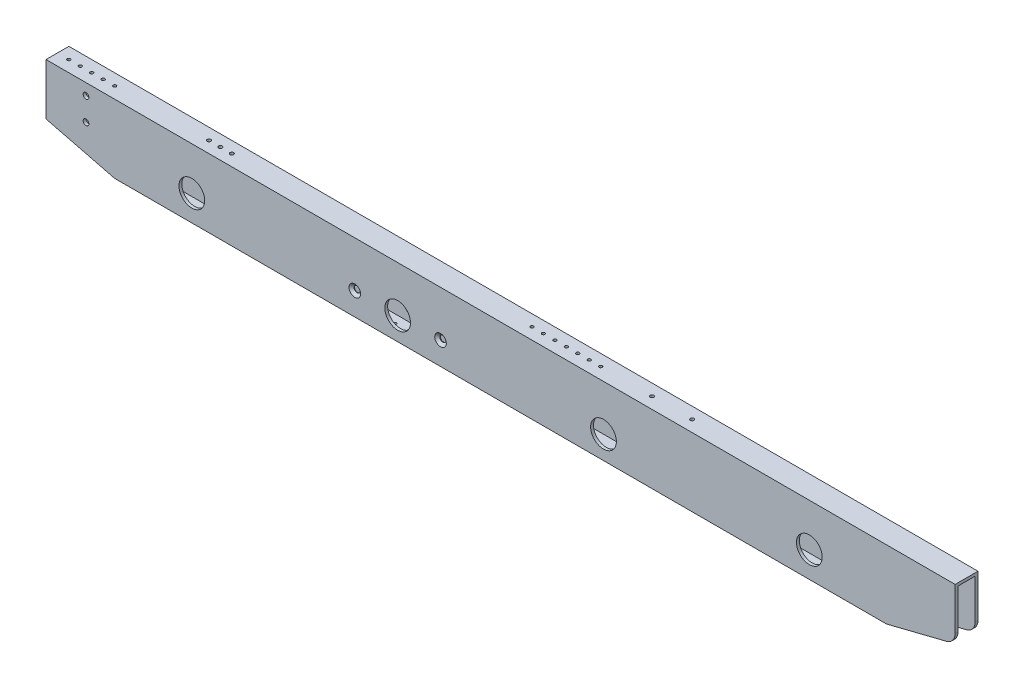
from build123d import *

# Parameters (mm, degrees)
SKETCH1_W                                           = 1009.65
SKETCH1_H                                           = 76.2
SKETCH1_R                                           = 14.2875
BOSS_EXTRUDE2_DEPTH                                 = 12.7
SKETCH3_W                                           = 19.05
SKETCH3_H                                           = 69.85
CUT_EXTRUDE2_DEPTH                                  = 1011.448426442
CUT_EXTRUDE3_DEPTH                                  = 507.897475457
FILLET1_R                                           = 12.7
SKETCH9_R                                           = 1.7272
CUT_EXTRUDE5_DEPTH                                  = 6.35
SKETCH12_R                                          = 1.7272
CUT_EXTRUDE8_DEPTH                                  = 5.08
CSK_FOR_1_4_FLAT_HEAD_MACHINE_SCREW_100_D           = 6.7564
CSK_FOR_1_4_FLAT_HEAD_MACHINE_SCREW_100_CSINK_D     = 12.8778
CSK_FOR_1_4_FLAT_HEAD_MACHINE_SCREW_100_CSINK_ANGLE = 100
CUT_EXTRUDE9_START                                  = -6.35
SKETCH15_R                                          = 1.7272
CUT_EXTRUDE9_DEPTH                                  = 6.35
SKETCH16_R                                          = 17.4625
CUT_EXTRUDE10_DEPTH                                 = 3.81
F_1_4_0_25_DIAMETER_HOLE1_D                         = 6.35
F_10_32_TAPPED_HOLE2_D                              = 4.0386
F_10_32_TAPPED_HOLE2_DEPTH                          = 13.716
F_10_32_TAPPED_HOLE2_TIP                            = 1.213317848
F_10_32_TAPPED_HOLE3_D                              = 4.0386


with BuildPart() as part:
    # Sketch1 → Boss-Extrude2 (new, symmetric)
    with BuildSketch(Plane.XY):
        Rectangle(SKETCH1_W, SKETCH1_H)
        with Locations((114.3, -12.7)):
            Circle(SKETCH1_R, mode=Mode.SUBTRACT)
        with Locations((-342.9, -9.525)):
            Circle(SKETCH1_R, mode=Mode.SUBTRACT)
        with Locations((342.9, -9.525)):
            Circle(SKETCH1_R, mode=Mode.SUBTRACT)
        with Locations((-114.3, -12.7)):
            Circle(SKETCH1_R, mode=Mode.SUBTRACT)
    extrude(amount=BOSS_EXTRUDE2_DEPTH, both=True)

    # Sketch3 → Cut-Extrude2 (cut, through all)
    with BuildSketch(Plane(origin=(504.825, 0, 0), x_dir=(0, 0, -1), z_dir=(1, 0, 0))):
        Rectangle(SKETCH3_W, SKETCH3_H)
    extrude(amount=-CUT_EXTRUDE2_DEPTH, mode=Mode.SUBTRACT)

    # Sketch4 → Cut-Extrude3 (cut, through all)
    with BuildSketch(Plane.XY.offset(12.7)):
        Polygon((-504.825, -38.1), (-504.825, -19.05), (-428.625, -38.1), align=None)
        Polygon((428.625, -38.1), (504.825, -38.1), (504.825, -19.05), align=None)
    extrude(amount=-CUT_EXTRUDE3_DEPTH, mode=Mode.SUBTRACT)

    # Fillet1
    fillet1_edges = [part.edges().sort_by_distance(p)[0] for p in [
        (504.825, -19.05, -11.1125),
        (504.825, -19.05, 11.1125),
    ]]
    fillet(fillet1_edges, radius=FILLET1_R)

    # Sketch9 → Cut-Extrude5 (cut)
    with BuildSketch(Plane(origin=(0, 38.1, 0), x_dir=(1, 0, 0), z_dir=(0, 1, 0))):
        with Locations((-492.125, 0)):
            Circle(SKETCH9_R)
        with Locations((-441.325, 0)):
            Circle(SKETCH9_R)
        with Locations((-479.425, 0)):
            Circle(SKETCH9_R)
        with Locations((-466.725, 0)):
            Circle(SKETCH9_R)
        with Locations((-454.025, 0)):
            Circle(SKETCH9_R)
    extrude(amount=-CUT_EXTRUDE5_DEPTH, mode=Mode.SUBTRACT)

    # Sketch12 → Cut-Extrude8 (cut)
    with BuildSketch(Plane(origin=(0, 38.1, 0), x_dir=(1, 0, 0), z_dir=(0, 1, 0))):
        with Locations((98.425, 0)):
            Circle(SKETCH12_R)
        with Locations((85.725, 0)):
            Circle(SKETCH12_R)
        with Locations((73.025, 0)):
            Circle(SKETCH12_R)
        with Locations((60.325, 0)):
            Circle(SKETCH12_R)
        with Locations((47.625, 0)):
            Circle(SKETCH12_R)
        with Locations((34.925, 0)):
            Circle(SKETCH12_R)
        with Locations((22.225, 0)):
            Circle(SKETCH12_R)
    extrude(amount=-CUT_EXTRUDE8_DEPTH, mode=Mode.SUBTRACT)

    # CSK for 1/4 Flat Head Machine Screw (100)1 (through all)
    with Locations(Plane.XY.offset(12.7)):
        with Locations((-66.675, -12.7), (-161.925, -12.7)):
            CounterSinkHole(CSK_FOR_1_4_FLAT_HEAD_MACHINE_SCREW_100_D / 2, CSK_FOR_1_4_FLAT_HEAD_MACHINE_SCREW_100_CSINK_D / 2, counter_sink_angle=CSK_FOR_1_4_FLAT_HEAD_MACHINE_SCREW_100_CSINK_ANGLE)

    # Sketch15 → Cut-Extrude9 (cut)
    with BuildSketch(Plane(origin=(0, -38.1, 0), x_dir=(-1, 0, 0), z_dir=(0, -1, 0)).offset(CUT_EXTRUDE9_START)):
        with Locations((415.925, 0)):
            Circle(SKETCH15_R)
        with Locations((396.875, 0)):
            Circle(SKETCH15_R)
        with Locations((377.825, 0)):
            Circle(SKETCH15_R)
        with Locations((358.775, 0)):
            Circle(SKETCH15_R)
        with Locations((339.725, 0)):
            Circle(SKETCH15_R)
        with Locations((320.675, 0)):
            Circle(SKETCH15_R)
        with Locations((301.625, 0)):
            Circle(SKETCH15_R)
        with Locations((282.575, 0)):
            Circle(SKETCH15_R)
        with Locations((263.525, 0)):
            Circle(SKETCH15_R)
        with Locations((244.475, 0)):
            Circle(SKETCH15_R)
        with Locations((225.425, 0)):
            Circle(SKETCH15_R)
        with Locations((206.375, 0)):
            Circle(SKETCH15_R)
        with Locations((187.325, 0)):
            Circle(SKETCH15_R)
        with Locations((168.275, 0)):
            Circle(SKETCH15_R)
        with Locations((149.225, 0)):
            Circle(SKETCH15_R)
        with Locations((130.175, 0)):
            Circle(SKETCH15_R)
        with Locations((111.125, 0)):
            Circle(SKETCH15_R)
        with Locations((92.075, 0)):
            Circle(SKETCH15_R)
        with Locations((73.025, 0)):
            Circle(SKETCH15_R)
        with Locations((53.975, 0)):
            Circle(SKETCH15_R)
        with Locations((34.925, 0)):
            Circle(SKETCH15_R)
        with Locations((15.875, 0)):
            Circle(SKETCH15_R)
        with Locations((-3.175, 0)):
            Circle(SKETCH15_R)
        with Locations((-22.225, 0)):
            Circle(SKETCH15_R)
        with Locations((-41.275, 0)):
            Circle(SKETCH15_R)
        with Locations((-60.325, 0)):
            Circle(SKETCH15_R)
    extrude(amount=CUT_EXTRUDE9_DEPTH, mode=Mode.SUBTRACT)

    # Sketch16 → Cut-Extrude10 (cut)
    with BuildSketch(Plane(origin=(0, 0, -12.7), x_dir=(-1, 0, 0), z_dir=(0, 0, -1))):
        with Locations((114.3, -12.7)):
            Circle(SKETCH16_R)
    extrude(amount=-CUT_EXTRUDE10_DEPTH, mode=Mode.SUBTRACT)

    # 1/4 (0.25) Diameter Hole1 (through all)
    with Locations(Plane.XY.offset(12.7)):
        with Locations((-460.375, 25.4), (-460.375, 0)):
            Hole(F_1_4_0_25_DIAMETER_HOLE1_D / 2)

    # #10-32 Tapped Hole2
    with Locations(Plane(origin=(0, 38.1, 0), x_dir=(1, 0, 0), z_dir=(0, 1, 0))):
        with Locations((155.575, 0), (200.025, 0)):
            Hole(F_10_32_TAPPED_HOLE2_D / 2, depth=F_10_32_TAPPED_HOLE2_DEPTH)
            with Locations((0, 0, -(F_10_32_TAPPED_HOLE2_DEPTH + F_10_32_TAPPED_HOLE2_TIP / 2))):  # 118° drill point
                Cone(0, F_10_32_TAPPED_HOLE2_D / 2, F_10_32_TAPPED_HOLE2_TIP, mode=Mode.SUBTRACT)

    # #10-32 Tapped Hole3 (through all)
    with Locations(Plane(origin=(0, 38.1, 0), x_dir=(1, 0, 0), z_dir=(0, 1, 0))):
        with Locations((-336.55, 0), (-311.15, 0), (-323.85, 0)):
            Hole(F_10_32_TAPPED_HOLE3_D / 2)


solid = part.part
